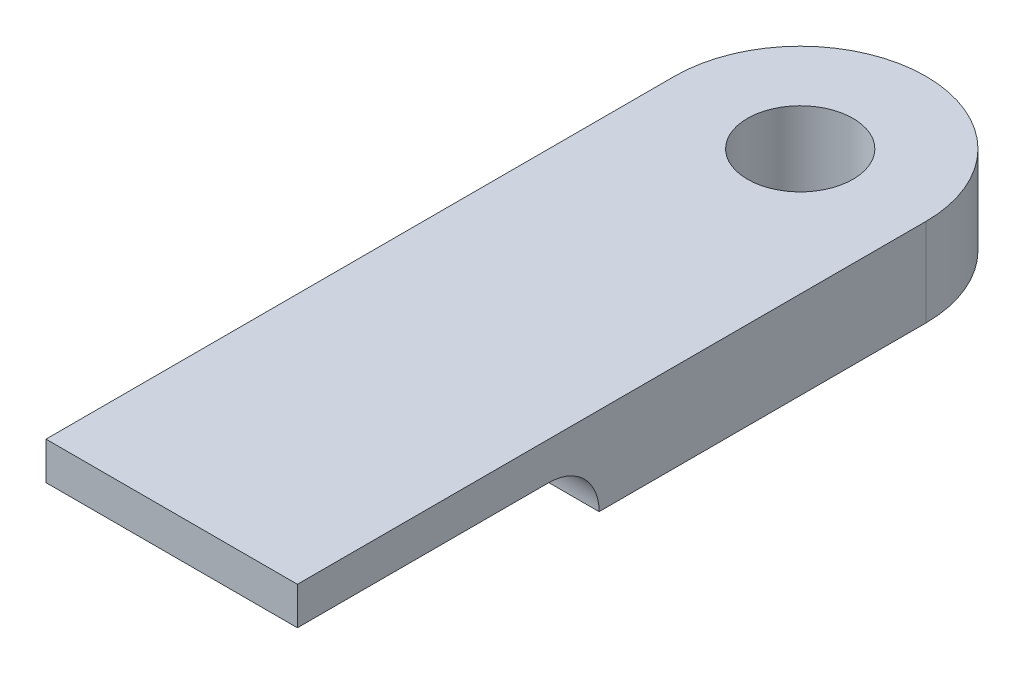
from build123d import *

# Parameters (mm, degrees)
CROQUIS1_W              = 10
CROQUIS1_H              = 30
SALIENTE_EXTRUIR1_DEPTH = 1.75
REDONDEO1_R             = 5
CROQUIS2_R              = 2.1
CORTAR_EXTRUIR1_DEPTH   = 3.5
CROQUIS3_W              = 10
CROQUIS3_H              = 12
CORTAR_EXTRUIR2_DEPTH   = 2
REDONDEO2_R             = 2


with BuildPart() as part:
    # Croquis1 → Saliente-Extruir1 (new, symmetric)
    with BuildSketch(Plane(origin=(0, 0, 0), x_dir=(1, 0, 0), z_dir=(0, 1, 0))):
        Rectangle(CROQUIS1_W, CROQUIS1_H)
    extrude(amount=SALIENTE_EXTRUIR1_DEPTH, both=True)

    # Redondeo1
    redondeo1_edges = [part.edges().sort_by_distance(p)[0] for p in [
        (5, 0, -15),
        (-5, 0, -15),
    ]]
    fillet(redondeo1_edges, radius=REDONDEO1_R - 0.0001)  # a hair under: the kernel refuses the full size

    # Croquis2 → Cortar-Extruir1 (cut)
    with BuildSketch(Plane(origin=(0, 1.75, 0), x_dir=(1, 0, 0), z_dir=(0, 1, 0))):
        with Locations(Location((0, 10, 0), (0, 0, 270))):
            Circle(CROQUIS2_R)
    extrude(amount=-CORTAR_EXTRUIR1_DEPTH, mode=Mode.SUBTRACT)

    # Croquis3 → Cortar-Extruir2 (cut)
    with BuildSketch(Plane.XZ.offset(1.75)):
        with Locations((0, 9)):
            Rectangle(CROQUIS3_W, CROQUIS3_H)
    extrude(amount=-CORTAR_EXTRUIR2_DEPTH, mode=Mode.SUBTRACT)

    # Redondeo2
    redondeo2_edges = [part.edges().sort_by_distance(p)[0] for p in [
        (0, 0.25, 3),
    ]]
    fillet(redondeo2_edges, radius=REDONDEO2_R - 0.0001)  # a hair under: the kernel refuses the full size


solid = part.part
